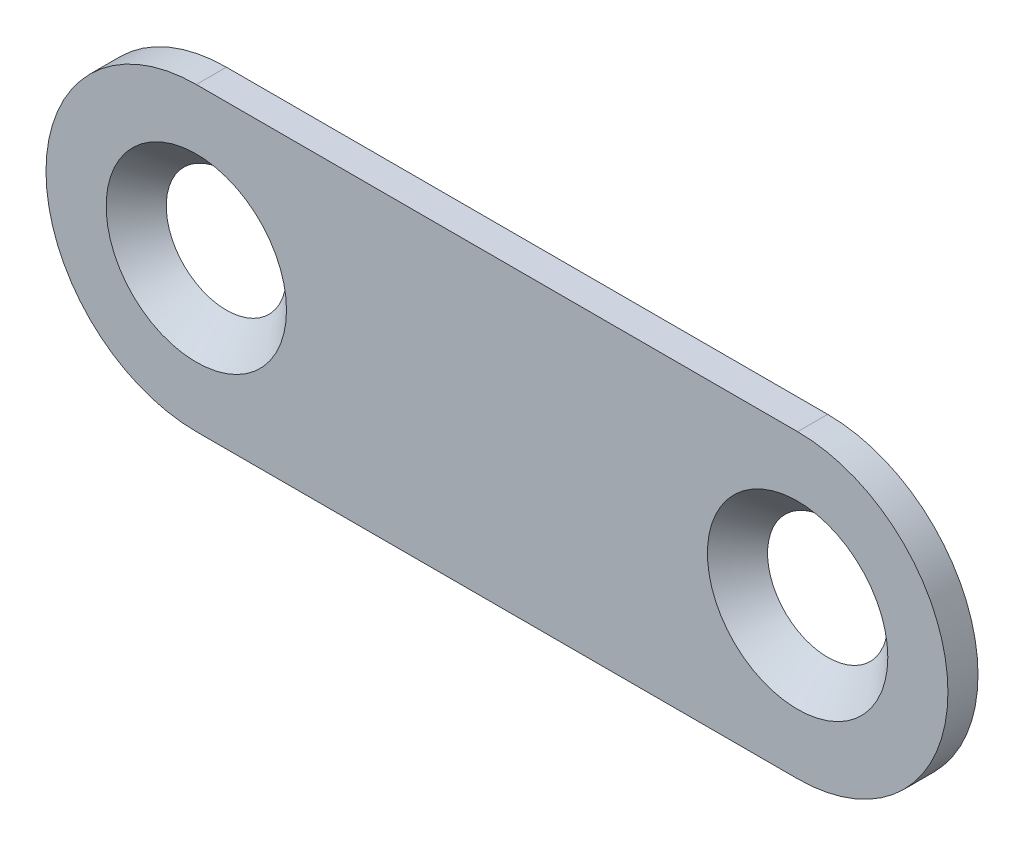
from build123d import *

# Parameters (mm, degrees)
ESQUISSE1_R        = 2
BOSS_EXTRU_1_DEPTH = 1
CHANFREIN1_SIZE    = 1


with BuildPart() as part:
    # Esquisse1 → Boss.-Extru.1 (new body)
    with BuildSketch(Plane.XY):
        with BuildLine():
            Line((0, 0), (20, 0))
            ThreePointArc((20, 0), (25, -5), (20, -10))
            Line((20, -10), (0, -10))
            ThreePointArc((0, -10), (-5, -5), (0, 0))
        make_face()
        with Locations((0, -5)):
            Circle(ESQUISSE1_R, mode=Mode.SUBTRACT)
        with Locations((20, -5)):
            Circle(ESQUISSE1_R, mode=Mode.SUBTRACT)
    extrude(amount=BOSS_EXTRU_1_DEPTH)

    # Chanfrein1
    chanfrein1_edges = [part.edges().sort_by_distance(p)[0] for p in [
        (-2, -5, 1),
        (18, -5, 1),
    ]]
    chamfer(chanfrein1_edges, length=CHANFREIN1_SIZE - 0.0001)  # a hair under: the kernel refuses the full size


solid = part.part
